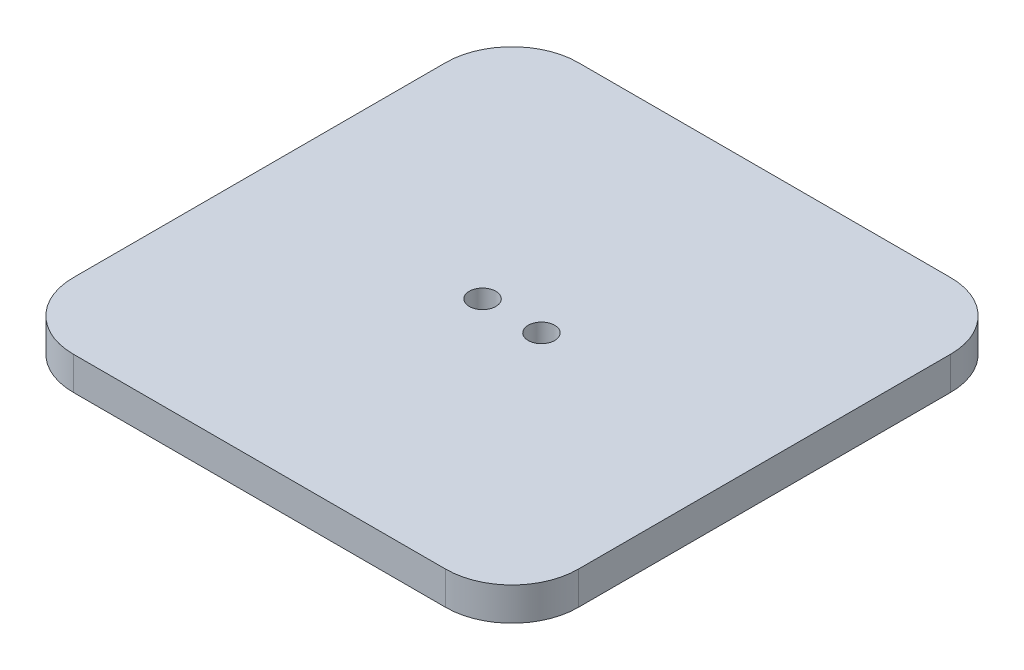
from build123d import *

# Parameters (mm, degrees)
SKETCH1_W           = 76.2
SKETCH1_H           = 76.2
BOSS_EXTRUDE1_DEPTH = 5
FILLET1_R           = 10
FILLET2_R           = 10
FILLET3_R           = 10
FILLET4_R           = 10
SKETCH2_R           = 2
CUT_EXTRUDE1_DEPTH  = 55.113029854


with BuildPart() as part:
    # Sketch1 → Boss-Extrude1 (new body)
    with BuildSketch(Plane(origin=(0, 0, 0), x_dir=(1, 0, 0), z_dir=(0, 1, 0))):
        Rectangle(SKETCH1_W, SKETCH1_H)
    extrude(amount=BOSS_EXTRUDE1_DEPTH)

    # Fillet1
    fillet1_edges = [part.edges().sort_by_distance(p)[0] for p in [
        (-38.1, 2.5, 38.1),
    ]]
    fillet(fillet1_edges, radius=FILLET1_R)

    # Fillet2
    fillet2_edges = [part.edges().sort_by_distance(p)[0] for p in [
        (-38.1, 2.5, -38.1),
    ]]
    fillet(fillet2_edges, radius=FILLET2_R)

    # Fillet3
    fillet3_edges = [part.edges().sort_by_distance(p)[0] for p in [
        (38.1, 2.5, -38.1),
    ]]
    fillet(fillet3_edges, radius=FILLET3_R)

    # Fillet4
    fillet4_edges = [part.edges().sort_by_distance(p)[0] for p in [
        (38.1, 2.5, 38.1),
    ]]
    fillet(fillet4_edges, radius=FILLET4_R)

    # Sketch2 → Cut-Extrude1 (cut, through all)
    with BuildSketch(Plane(origin=(0, 5, 0), x_dir=(1, 0, 0), z_dir=(0, 1, 0))):
        with Locations((4.445, 0)):
            Circle(SKETCH2_R)
        with Locations((-4.445, 0)):
            Circle(SKETCH2_R)
    extrude(amount=-CUT_EXTRUDE1_DEPTH, mode=Mode.SUBTRACT)


solid = part.part
